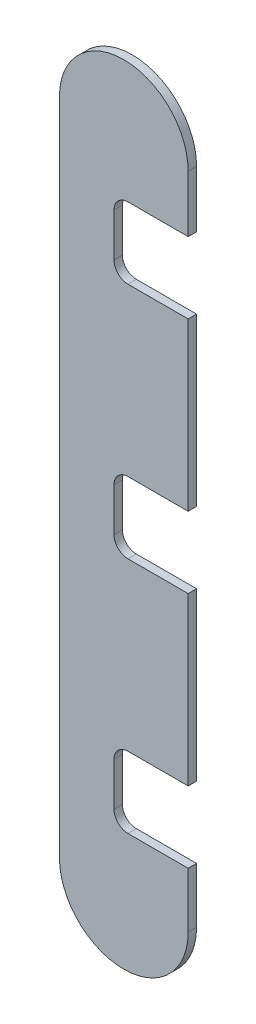
from build123d import *

# Parameters (mm, degrees)
BOSS_EXTRUDE1_DEPTH = 3
FILLET1_R           = 5


with BuildPart() as part:
    # Sketch1 → Boss-Extrude1 (new body)
    with BuildSketch(Plane.XY):
        with BuildLine():
            Line((-23.5, 139.962429423), (-23.5, 114.5))
            Line((-23.5, 114.5), (3, 114.5))
            Line((3, 114.5), (3, 54.962429423))
            Line((3, 54.962429423), (-23.5, 54.962429423))
            Line((-23.5, 54.962429423), (-23.5, 29.5))
            Line((-23.5, 29.5), (3, 29.5))
            Line((3, 29.5), (3, -30.037570577))
            Line((3, -30.037570577), (-23.5, -30.037570577))
            Line((-23.5, -30.037570577), (-23.5, -55.5))
            Line((-23.5, -55.5), (3, -55.5))
            Line((3, -55.5), (3, -75.25))
            ThreePointArc((3, -75.25), (-20, -98.25), (-43, -75.25))
            Line((-43, -75.25), (-43, 160.25))
            ThreePointArc((-43, 160.25), (-20, 183.25), (3, 160.25))
            Line((3, 160.25), (3, 139.962429423))
            Line((3, 139.962429423), (-23.5, 139.962429423))
        make_face()
    extrude(amount=BOSS_EXTRUDE1_DEPTH)

    # Fillet1
    fillet1_edges = [part.edges().sort_by_distance(p)[0] for p in [
        (-23.5, 139.962429423, 1.5),
        (-23.5, 114.5, 1.5),
        (-23.5, 54.962429423, 1.5),
        (-23.5, 29.5, 1.5),
        (-23.5, -55.5, 1.5),
        (-23.5, -30.037570577, 1.5),
    ]]
    fillet(fillet1_edges, radius=FILLET1_R)


solid = part.part
